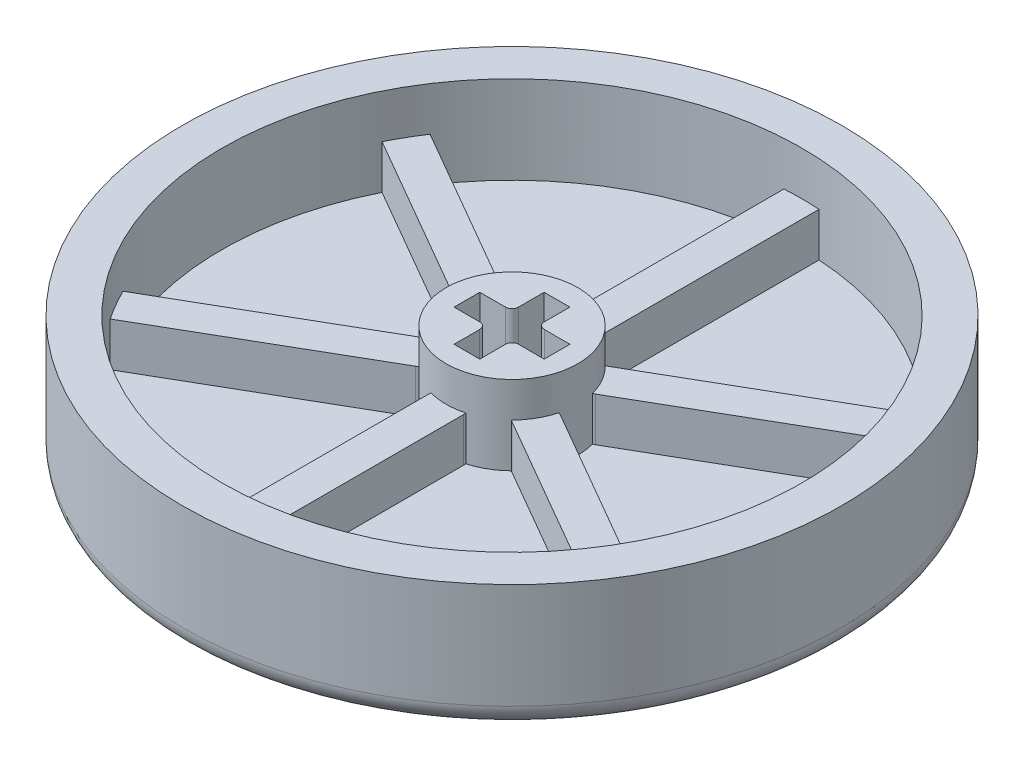
from build123d import *

# Parameters (mm, degrees)
SKETCH1_R           = 15
BUTTON_TOP_DEPTH    = 1.8
SKETCH2_R           = 15
SKETCH2_R_2         = 13.2
BUTTON_WALLS_DEPTH  = 4
SKETCH3_R           = 3
STEM_HOUSING_DEPTH  = 3.6
BOSS_EXTRUDE4_DEPTH = 2
FILLET1_R           = 1


with BuildPart() as part:
    # Sketch1 → button top (new body)
    with BuildSketch(Plane(origin=(0, 0, 0), x_dir=(1, 0, 0), z_dir=(0, 1, 0))):
        Circle(SKETCH1_R)
    extrude(amount=BUTTON_TOP_DEPTH)

    # Sketch2 → button walls (add)
    with BuildSketch(Plane(origin=(0, 1.8, 0), x_dir=(1, 0, 0), z_dir=(0, 1, 0))):
        Circle(SKETCH2_R)
        Circle(SKETCH2_R_2, mode=Mode.SUBTRACT)
    extrude(amount=BUTTON_WALLS_DEPTH)

    # Sketch3 → stem housing (add)
    with BuildSketch(Plane(origin=(0, 1.8, 0), x_dir=(1, 0, 0), z_dir=(0, 1, 0))):
        Circle(SKETCH3_R)
        with BuildLine():
            Line((-0.585, 0.885), (-0.585, 2.05))
            Line((-0.585, 2.05), (0.585, 2.05))
            Line((0.585, 2.05), (0.585, 0.885))
            ThreePointArc((0.585, 0.885), (0.672867966, 0.672867966), (0.885, 0.585))
            Line((0.885, 0.585), (2.05, 0.585))
            Line((2.05, 0.585), (2.05, -0.585))
            Line((2.05, -0.585), (0.885, -0.585))
            ThreePointArc((0.885, -0.585), (0.672867966, -0.672867966), (0.585, -0.885))
            Line((0.585, -0.885), (0.585, -2.05))
            Line((0.585, -2.05), (-0.585, -2.05))
            Line((-0.585, -2.05), (-0.585, -0.885))
            ThreePointArc((-0.585, -0.885), (-0.672867966, -0.672867966), (-0.885, -0.585))
            Line((-0.885, -0.585), (-2.05, -0.585))
            Line((-2.05, -0.585), (-2.05, 0.585))
            Line((-2.05, 0.585), (-0.885, 0.585))
            ThreePointArc((-0.885, 0.585), (-0.672867966, 0.672867966), (-0.585, 0.885))
        make_face(mode=Mode.SUBTRACT)
    extrude(amount=STEM_HOUSING_DEPTH)

    # Sketch4 → Boss-Extrude4 (add)
    with BuildSketch(Plane(origin=(0, 1.8, 0), x_dir=(1, 0, 0), z_dir=(0, 1, 0))):
        with BuildLine():
            Line((-0.8, 3), (-0.8, 13.2))
            ThreePointArc((-0.8, 13.2), (0, 14), (0.8, 13.2))
            Line((0.8, 13.2), (0.8, 3))
            ThreePointArc((0.8, 3), (0, 2.2), (-0.8, 3))
        make_face()
        with BuildLine():
            Line((2.198076211, 2.192820323), (11.03153533, 7.292820323))
            ThreePointArc((11.03153533, 7.292820323), (12.124355653, 7), (11.83153533, 5.907179677))
            Line((11.83153533, 5.907179677), (2.998076211, 0.807179677))
            ThreePointArc((2.998076211, 0.807179677), (1.905255888, 1.1), (2.198076211, 2.192820323))
        make_face()
        with BuildLine():
            Line((2.998076211, -0.807179677), (11.83153533, -5.907179677))
            ThreePointArc((11.83153533, -5.907179677), (12.124355653, -7), (11.03153533, -7.292820323))
            Line((11.03153533, -7.292820323), (2.198076211, -2.192820323))
            ThreePointArc((2.198076211, -2.192820323), (1.905255888, -1.1), (2.998076211, -0.807179677))
        make_face()
        with BuildLine():
            Line((0.8, -3), (0.8, -13.2))
            ThreePointArc((0.8, -13.2), (0, -14), (-0.8, -13.2))
            Line((-0.8, -13.2), (-0.8, -3))
            ThreePointArc((-0.8, -3), (0, -2.2), (0.8, -3))
        make_face()
        with BuildLine():
            Line((-2.198076211, -2.192820323), (-11.03153533, -7.292820323))
            ThreePointArc((-11.03153533, -7.292820323), (-12.124355653, -7), (-11.83153533, -5.907179677))
            Line((-11.83153533, -5.907179677), (-2.998076211, -0.807179677))
            ThreePointArc((-2.998076211, -0.807179677), (-1.905255888, -1.1), (-2.198076211, -2.192820323))
        make_face()
        with BuildLine():
            Line((-2.998076211, 0.807179677), (-11.83153533, 5.907179677))
            ThreePointArc((-11.83153533, 5.907179677), (-12.124355653, 7), (-11.03153533, 7.292820323))
            Line((-11.03153533, 7.292820323), (-2.198076211, 2.192820323))
            ThreePointArc((-2.198076211, 2.192820323), (-1.905255888, 1.1), (-2.998076211, 0.807179677))
        make_face()
    extrude(amount=BOSS_EXTRUDE4_DEPTH)

    # Fillet1
    fillet1_edges = [part.edges().sort_by_distance(p)[0] for p in [
        (-15, 0, 0),
    ]]
    fillet(fillet1_edges, radius=FILLET1_R)


solid = part.part
